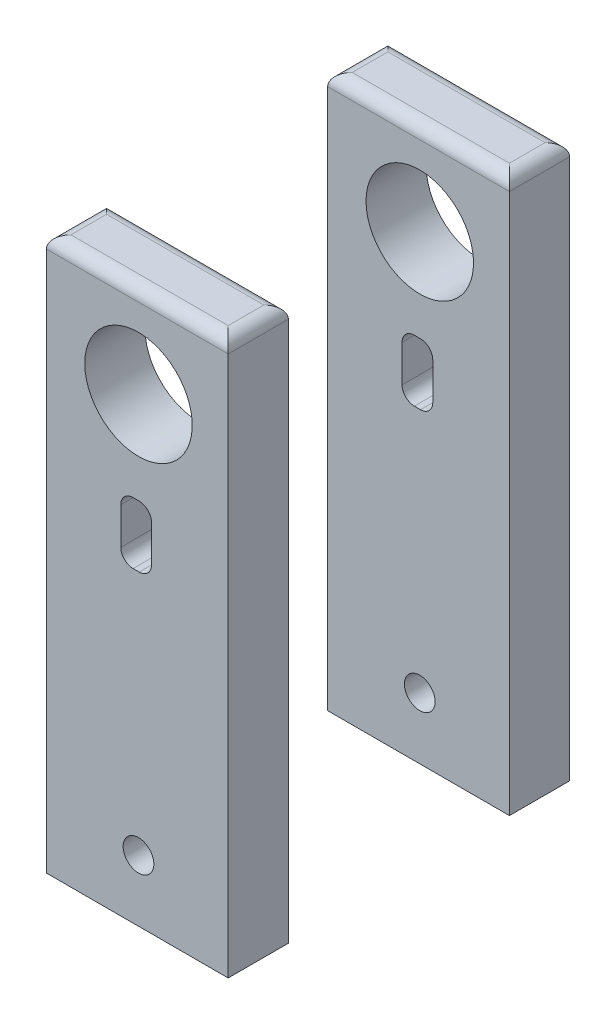
from build123d import *

# Parameters (mm, degrees)
SKETCH2_W           = 37.592
SKETCH2_H           = 12.446
BOSS_EXTRUDE1_DEPTH = 114.3
SKETCH3_R           = 3.175
CUT_EXTRUDE1_DEPTH  = 12.7
SKETCH4_R           = 11.1125
CUT_EXTRUDE2_DEPTH  = 12.7
SKETCH5_W           = 6.35
SKETCH5_H           = 12.7
CUT_EXTRUDE3_DEPTH  = 12.7
FILLET2_R           = 2.54
FILLET3_R           = 2.54
FILLET4_R           = 2.54
FILLET5_R           = 2.54


with BuildPart() as part:
    # Sketch2 → Boss-Extrude1 (new body)
    with BuildSketch(Plane(origin=(0, 0, 0), x_dir=(1, 0, 0), z_dir=(0, 1, 0))):
        with Locations((-0.254, 0)):
            Rectangle(SKETCH2_W, SKETCH2_H)
    extrude(amount=BOSS_EXTRUDE1_DEPTH)

    # Sketch3 → Cut-Extrude1 (cut)
    with BuildSketch(Plane(origin=(0, 0, -6.223), x_dir=(-1, 0, 0), z_dir=(0, 0, -1))):
        with Locations((0, 12.7)):
            Circle(SKETCH3_R)
    extrude(amount=-CUT_EXTRUDE1_DEPTH, mode=Mode.SUBTRACT)

    # Sketch4 → Cut-Extrude2 (cut)
    with BuildSketch(Plane(origin=(0, 0, -6.223), x_dir=(-1, 0, 0), z_dir=(0, 0, -1))):
        with Locations((0, 95.25)):
            Circle(SKETCH4_R)
    extrude(amount=-CUT_EXTRUDE2_DEPTH, mode=Mode.SUBTRACT)

    # Sketch5 → Cut-Extrude3 (cut)
    with BuildSketch(Plane(origin=(0, 0, -6.223), x_dir=(-1, 0, 0), z_dir=(0, 0, -1))):
        with Locations((0.486934661, 69.85)):
            Rectangle(SKETCH5_W, SKETCH5_H)
    extrude(amount=-CUT_EXTRUDE3_DEPTH, mode=Mode.SUBTRACT)


with BuildPart() as body_2:
    # Mirror7: mirrored copy
    add(part.part.mirror(Plane.XY.offset(29.083)))

    # Fillet3
    fillet3_edges = [body_2.edges().sort_by_distance(p)[0] for p in [
        (2.688065339, 63.5, 58.166),
        (2.688065339, 76.2, 58.166),
        (-3.661934661, 76.2, 58.166),
        (-3.661934661, 63.5, 58.166),
    ]]
    fillet(fillet3_edges, radius=FILLET3_R)

    # Fillet5
    fillet5_edges = [body_2.edges().sort_by_distance(p)[0] for p in [
        (-0.254, 114.3, 64.389),
        (-19.05, 114.3, 58.166),
        (-0.254, 114.3, 51.943),
        (18.542, 114.3, 58.166),
    ]]
    fillet(fillet5_edges, radius=FILLET5_R)


with BuildPart() as part_1:
    add(part.part)

    # Fillet2
    fillet2_edges = [part_1.edges().sort_by_distance(p)[0] for p in [
        (2.688065339, 76.2, 0),
        (-3.661934661, 76.2, 0),
        (2.688065339, 63.5, 0),
        (-3.661934661, 63.5, 0),
    ]]
    fillet(fillet2_edges, radius=FILLET2_R)

    # Fillet4
    fillet4_edges = [part_1.edges().sort_by_distance(p)[0] for p in [
        (18.542, 114.3, 0),
        (-0.254, 114.3, 6.223),
        (-19.05, 114.3, 0),
        (-0.254, 114.3, -6.223),
    ]]
    fillet(fillet4_edges, radius=FILLET4_R)


solid = Compound([body_2.part, part_1.part])
